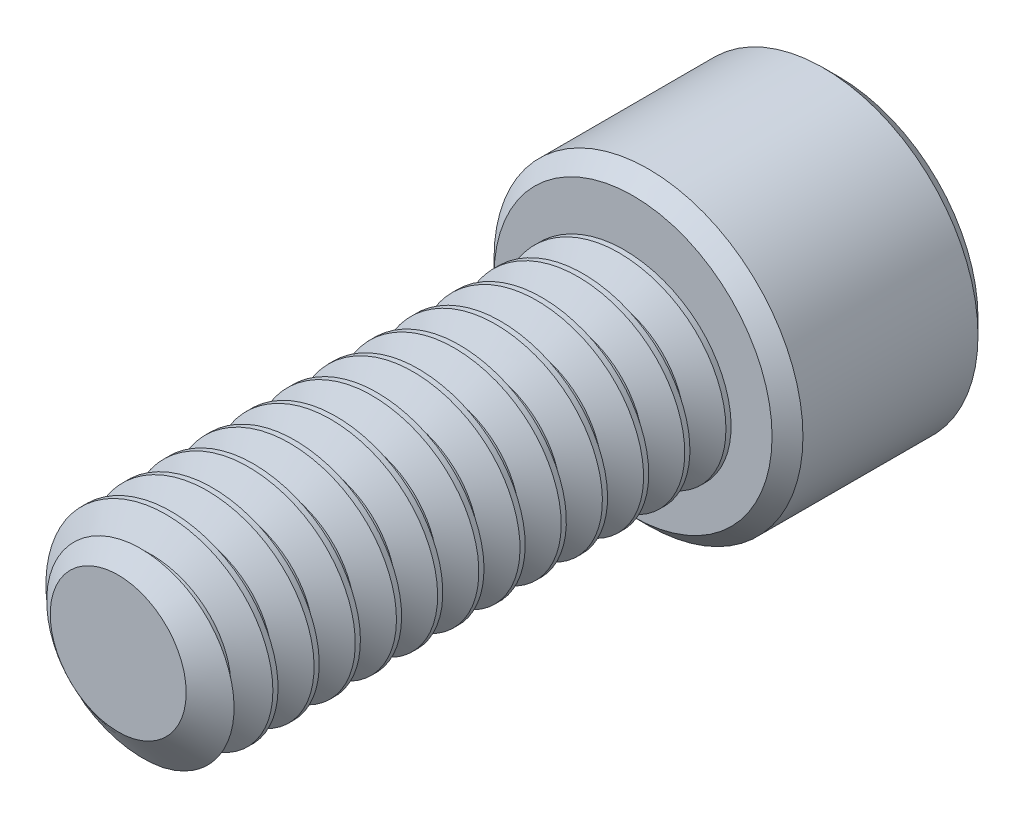
from build123d import *

# Parameters (mm, degrees)
SKETCH1_R          = 3.175
EXTRUDE1_DEPTH     = 15.875
CUT_SWEEP1_PITCH   = 1.27
SKETCH6_R          = 4.7625
EXTRUDE2_DEPTH     = 6.35
CUT_EXTRUDE1_DEPTH = 3.571875
CHAMFER1_SIZE      = 0.47625


with BuildPart() as part:
    # Sketch1 → Extrude1 (new body)
    with BuildSketch(Plane.XY):
        Circle(SKETCH1_R)
    extrude(amount=-EXTRUDE1_DEPTH)

    # Cut-Sweep1: the profile of Sketch3 profile screwed along a right-hand helix of 13.5 turns, 6 arcs to a turn; built about Z, then put on its axis
    cut_sweep1_z = Axis((0, 0, 0), (0, 0, 1))
    cut_sweep1_corners = [(3.1753, 0, -1.111423205), (2.350110803, 0, -0.635), (2.350110803, 0, -0.47625), (3.1753, 0, 0.000173205)]
    with BuildLine(mode=Mode.PRIVATE) as cut_sweep1_profile:
        Line(cut_sweep1_corners[0], cut_sweep1_corners[1])
        Line(cut_sweep1_corners[1], cut_sweep1_corners[2])
        Line(cut_sweep1_corners[2], cut_sweep1_corners[3])
        Line(cut_sweep1_corners[3], cut_sweep1_corners[0])
    cut_sweep1_cap = Face(cut_sweep1_profile.wire())
    cut_sweep1_turn_angles = [0, 30, 60, 90, 120, 150, 180, 210, 240, 270, 300, 330, 360]
    cut_sweep1_turn_weights = [1, 0.8660254037844387, 1, 0.8660254037844387, 1, 0.8660254037844387, 1, 0.8660254037844387, 1, 0.8660254037844387, 1, 0.8660254037844387, 1]
    cut_sweep1_turn_rails = [Edge.make_bspline([Vector(p[0], p[1], 0).rotate(cut_sweep1_z, cut_sweep1_turn_angles[k]) / cut_sweep1_turn_weights[k] + Vector(0, 0, p[2] + CUT_SWEEP1_PITCH * cut_sweep1_turn_angles[k] / 360) for k in range(13)], [0, 0, 0, 1, 1, 2, 2, 3, 3, 4, 4, 5, 5, 6, 6, 6], 2, cut_sweep1_turn_weights) for p in cut_sweep1_corners]
    cut_sweep1_turn_sides = [Face.make_surface_from_curves(cut_sweep1_turn_rails[p[0]], cut_sweep1_turn_rails[p[1]]) for p in [(0, 1), (1, 2), (2, 3), (3, 0)]]
    cut_sweep1_last_angles = [4680, 4710, 4740, 4770, 4800, 4830, 4860]
    cut_sweep1_last_weights = [1, 0.8660254037844387, 1, 0.8660254037844387, 1, 0.8660254037843712, 1]
    cut_sweep1_last_rails = [Edge.make_bspline([Vector(p[0], p[1], 0).rotate(cut_sweep1_z, cut_sweep1_last_angles[k]) / cut_sweep1_last_weights[k] + Vector(0, 0, p[2] + CUT_SWEEP1_PITCH * cut_sweep1_last_angles[k] / 360) for k in range(7)], [0, 0, 0, 1, 1, 2, 2, 3, 3, 3], 2, cut_sweep1_last_weights) for p in cut_sweep1_corners]
    cut_sweep1_last_sides = [Face.make_surface_from_curves(cut_sweep1_last_rails[p[0]], cut_sweep1_last_rails[p[1]]) for p in [(0, 1), (1, 2), (2, 3), (3, 0)]]
    cut_sweep1 = Plane(origin=(0, 0, 0), x_dir=(0, 1, 0), z_dir=(0, 0, -1)) * Solid(Shell([*[p.moved(Location((0, 0, CUT_SWEEP1_PITCH * i))) for i in range(13) for p in cut_sweep1_turn_sides], *cut_sweep1_last_sides, cut_sweep1_cap, cut_sweep1_cap.rotate(cut_sweep1_z, 4860).moved(Location((0, 0, CUT_SWEEP1_PITCH * 4860 / 360)))]))
    add(cut_sweep1, mode=Mode.SUBTRACT)

    # Sketch4 → Cut-Revolve1 (revolve, cut)
    with BuildSketch(Plane(origin=(0, 0, 0), x_dir=(0, 0, -1), z_dir=(1, 0, 0)), mode=Mode.PRIVATE) as cut_revolve1_sk:
        Polygon((0.755446349, 3.175), (0, 2.096110803), (0, 3.175), align=None)
    revolve(cut_revolve1_sk.sketch.rotate(Axis((0, 0, 0), (0, 0, -1)), 229.892048011), axis=Axis((0, 0, 0), (0, 0, -1)), mode=Mode.SUBTRACT)

    # Sketch6 → Extrude2 (add)
    with BuildSketch(Plane(origin=(0, 0, -15.875), x_dir=(-1, 0, 0), z_dir=(0, 0, -1))):
        Circle(SKETCH6_R)
    extrude(amount=EXTRUDE2_DEPTH)

    # Sketch7 → Cut-Extrude1 (cut)
    with BuildSketch(Plane(origin=(0, 0, -22.225), x_dir=(-1, 0, 0), z_dir=(0, 0, -1))):
        Polygon((0, 2.749630657), (-2.38125, 1.374815329), (-2.38125, -1.374815329), (0, -2.749630657), (2.38125, -1.374815329), (2.38125, 1.374815329), align=None)
    extrude(amount=-CUT_EXTRUDE1_DEPTH, mode=Mode.SUBTRACT)

    # Cut-Extrude2 cone 1 section (through the dimple's axis) → Cut-Extrude2 (revolve, cut)
    with BuildSketch(Plane(origin=(0, 0, -22.225), x_dir=(0, 1, 0), z_dir=(1, 0, 0))):
        Polygon((0, 0), (2.749630657, 0), (0, 2.749630657), align=None)
    revolve(axis=Axis((0, 0, -22.225), (0, 0, 1)), mode=Mode.SUBTRACT)

    # Chamfer1
    chamfer1_edges = [part.edges().sort_by_distance(p)[0] for p in [
        (4.7625, 0, -15.875),
        (4.7625, 0, -22.225),
    ]]
    chamfer(chamfer1_edges, length=CHAMFER1_SIZE)


solid = part.part
